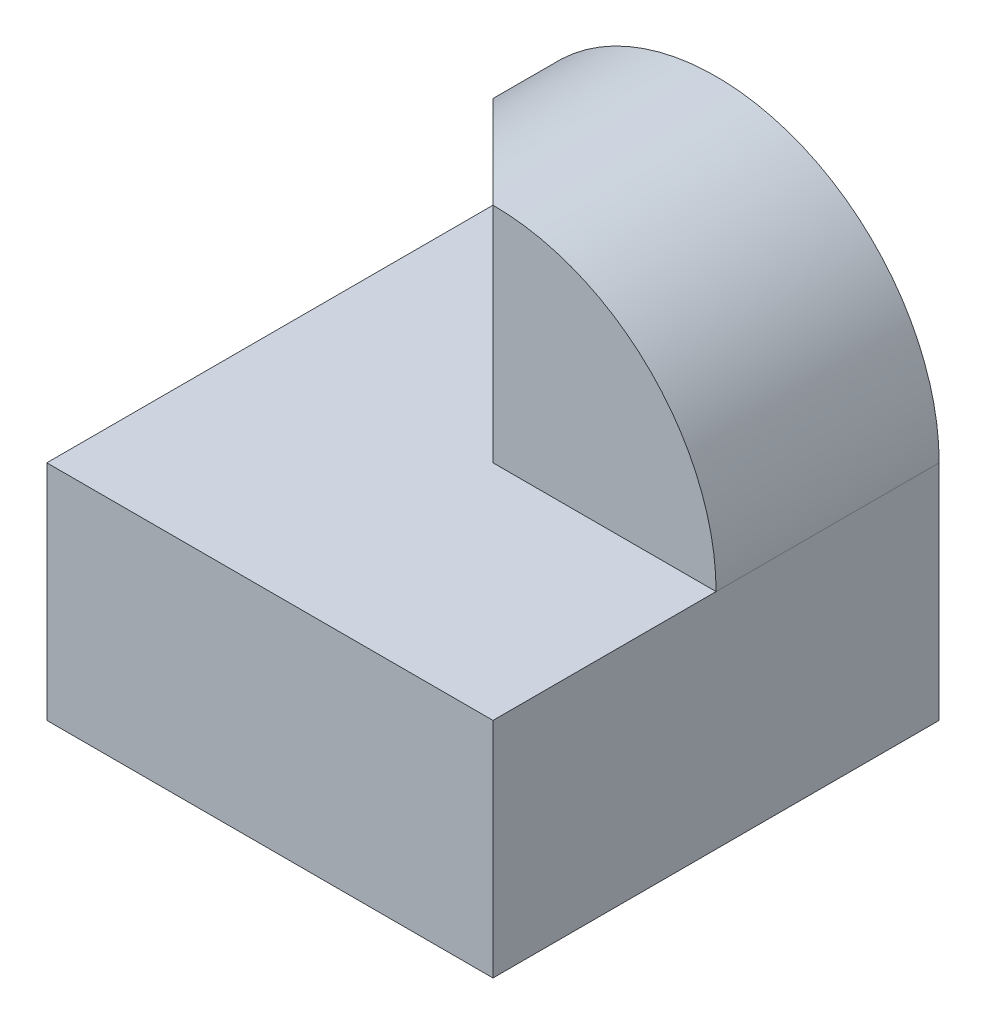
from build123d import *

# Parameters (mm, degrees)
SKETCH1_W           = 4
SKETCH1_H           = 4
BOSS_EXTRUDE1_DEPTH = 4
SKETCH2_W           = 4
SKETCH2_H           = 2
CUT_EXTRUDE1_DEPTH  = 2
CUT_EXTRUDE2_DEPTH  = 2
CUT_EXTRUDE3_DEPTH  = 2
CUT_EXTRUDE4_DEPTH  = 2


with BuildPart() as part:
    # Sketch1 → Boss-Extrude1 (new body)
    with BuildSketch(Plane(origin=(0, 0, 0), x_dir=(1, 0, 0), z_dir=(0, 1, 0))):
        Rectangle(SKETCH1_W, SKETCH1_H)
    extrude(amount=BOSS_EXTRUDE1_DEPTH)

    # Sketch2 → Cut-Extrude1 (cut)
    with BuildSketch(Plane.XY.offset(2)):
        with Locations((0, 3)):
            Rectangle(SKETCH2_W, SKETCH2_H)
    extrude(amount=-CUT_EXTRUDE1_DEPTH, mode=Mode.SUBTRACT)

    # Sketch3 → Cut-Extrude2 (cut)
    with BuildSketch(Plane(origin=(0, 0, -2), x_dir=(-1, 0, 0), z_dir=(0, 0, -1))):
        Polygon((2, 2), (0, 0), (2, 0), align=None)
    extrude(amount=-CUT_EXTRUDE2_DEPTH, mode=Mode.SUBTRACT)

    # Sketch4 → Cut-Extrude3 (cut)
    with BuildSketch(Plane.XY):
        with BuildLine():
            Line((-2, 4), (-2, 2))
            ThreePointArc((-2, 2), (-1.414213562, 3.414213562), (0, 4))
            Line((0, 4), (-2, 4))
        make_face()
        with BuildLine():
            Line((2, 4), (0, 4))
            ThreePointArc((0, 4), (1.414213562, 3.414213562), (2, 2))
            Line((2, 2), (2, 4))
        make_face()
    extrude(amount=-CUT_EXTRUDE3_DEPTH, mode=Mode.SUBTRACT)

    # Sketch5 → Cut-Extrude4 (cut)
    with BuildSketch(Plane(origin=(0, 2, 0), x_dir=(1, 0, 0), z_dir=(0, 1, 0))):
        Polygon((0, 0), (-2, 2), (-2, 0), align=None)
    extrude(amount=CUT_EXTRUDE4_DEPTH, mode=Mode.SUBTRACT)


solid = part.part
